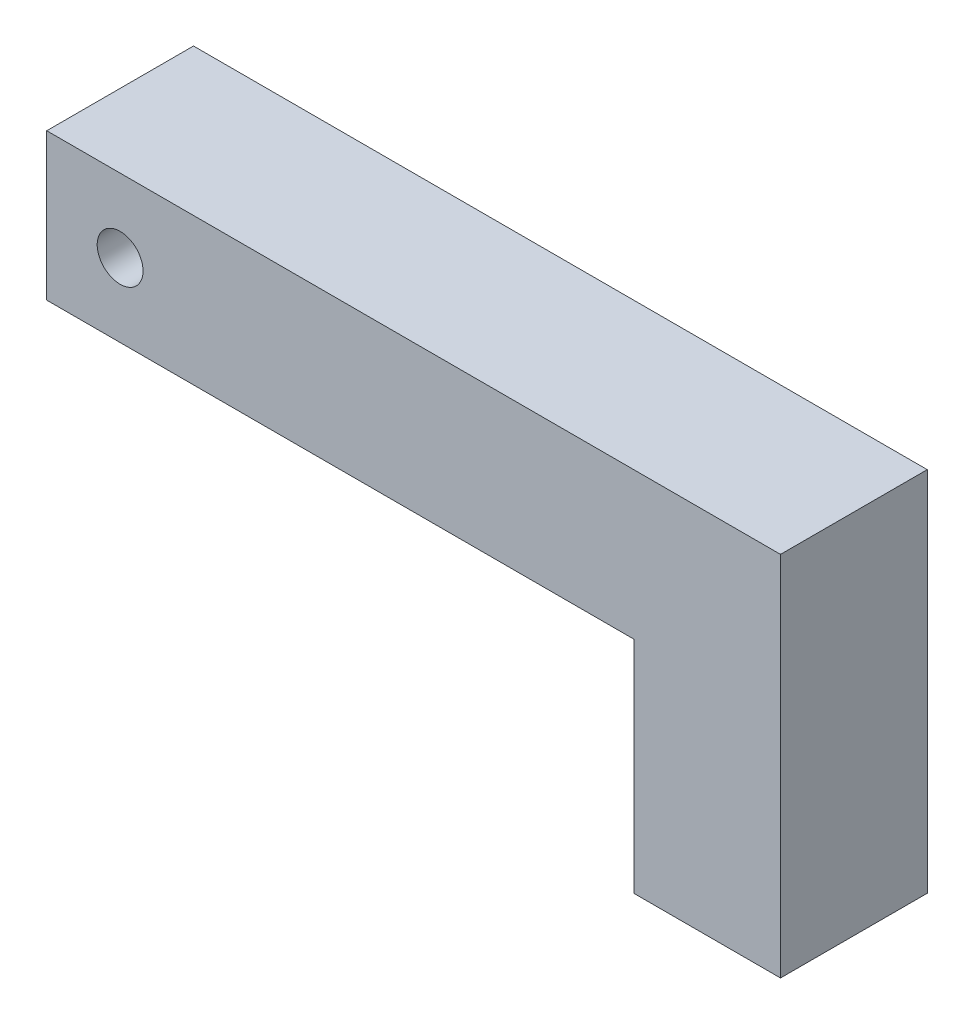
from build123d import *

# Parameters (mm, degrees)
BOSS_EXTRUDE1_DEPTH = 25.4
SKETCH2_R           = 3.96875
CUT_EXTRUDE1_DEPTH  = 136.002851822


with BuildPart() as part:
    # Sketch1 → Boss-Extrude1 (new body)
    with BuildSketch(Plane.XY):
        Polygon((0, 25.4), (0, 0), (101.6, 0), (101.6, -38.1), (127, -38.1), (127, 25.4), align=None)
    extrude(amount=BOSS_EXTRUDE1_DEPTH)

    # Sketch2 → Cut-Extrude1 (cut, through all)
    with BuildSketch(Plane.XY.offset(25.4)):
        with Locations((12.7, 12.7)):
            Circle(SKETCH2_R)
    extrude(amount=-CUT_EXTRUDE1_DEPTH, mode=Mode.SUBTRACT)


solid = part.part
